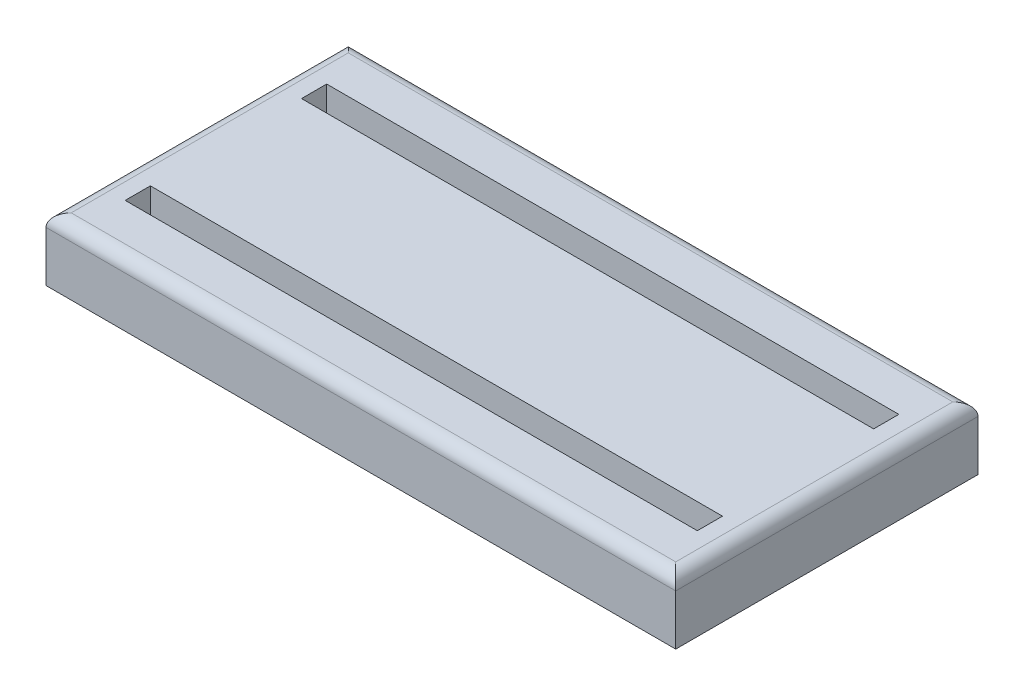
from build123d import *

# Parameters (mm, degrees)
SKETCH2_W           = 127
SKETCH2_H           = 60.96
BOSS_EXTRUDE1_DEPTH = 12.7
FILLET1_R           = 2.54
SKETCH3_W           = 115.38555028
SKETCH3_H           = 5.08
CUT_EXTRUDE1_DEPTH  = 12.7


with BuildPart() as part:
    # Sketch2 → Boss-Extrude1 (new body)
    with BuildSketch(Plane(origin=(0, 0, 0), x_dir=(1, 0, 0), z_dir=(0, 1, 0))):
        with Locations((0, -12.7)):
            Rectangle(SKETCH2_W, SKETCH2_H)
    extrude(amount=BOSS_EXTRUDE1_DEPTH)

    # Fillet1
    fillet1_edges = [part.edges().sort_by_distance(p)[0] for p in [
        (63.5, 12.7, 12.7),
        (-63.5, 12.7, 12.7),
        (0, 12.7, 43.18),
        (0, 12.7, -17.78),
    ]]
    fillet(fillet1_edges, radius=FILLET1_R)

    # Sketch3 → Cut-Extrude1 (cut)
    with BuildSketch(Plane(origin=(0, 12.7, 0), x_dir=(1, 0, 0), z_dir=(0, 1, 0))):
        with Locations((-2.54e-06, 5.08)):
            Rectangle(SKETCH3_W, SKETCH3_H)
        with Locations((-2.54e-06, -30.48)):
            Rectangle(SKETCH3_W, SKETCH3_H)
    extrude(amount=-CUT_EXTRUDE1_DEPTH, mode=Mode.SUBTRACT)


solid = part.part
